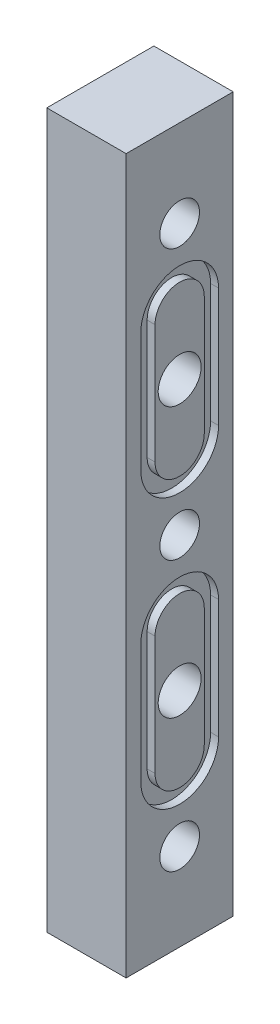
from build123d import *

# Parameters (mm, degrees)
SKETCH1_W                    = 13.5
SKETCH1_H                    = 90
BOSS_EXTRUDE1_DEPTH          = 10
F_1_4_28_TAPPED_HOLE1_D      = 5.4102
F_5_0_5_DIAMETER_HOLE1_D     = 5
F_5_0_5_DIAMETER_HOLE1_DEPTH = 49.5
F_5_0_5_DIAMETER_HOLE1_TIP   = 1.502151548
CUT_EXTRUDE1_DEPTH           = 1
CUT_EXTRUDE2_DEPTH           = 5


with BuildPart() as part:
    # Sketch1 → Boss-Extrude1 (new body)
    with BuildSketch(Plane(origin=(0, 0, 0), x_dir=(0, 0, -1), z_dir=(1, 0, 0))):
        with Locations((1.965094474, 8.62782)):
            Rectangle(SKETCH1_W, SKETCH1_H)
    extrude(amount=BOSS_EXTRUDE1_DEPTH)

    # 1/4-28 Tapped Hole1 (through all)
    with Locations(Plane(origin=(10, 0, 0), x_dir=(0, 0, -1), z_dir=(1, 0, 0))):
        with Locations((1.965094474, 25.62782), (1.965094474, -8.37218)):
            Hole(F_1_4_28_TAPPED_HOLE1_D / 2)

    # Ø5.0 (5) Diameter Hole1
    with Locations(Plane(origin=(10, 0, 0), x_dir=(0, 0, -1), z_dir=(1, 0, 0))):
        with Locations((1.965094474, 42.62782), (1.965094474, -25.37218), (1.965094474, 8.62782)):
            Hole(F_5_0_5_DIAMETER_HOLE1_D / 2, depth=F_5_0_5_DIAMETER_HOLE1_DEPTH)
            with Locations((0, 0, -(F_5_0_5_DIAMETER_HOLE1_DEPTH + F_5_0_5_DIAMETER_HOLE1_TIP / 2))):  # 118° drill point
                Cone(0, F_5_0_5_DIAMETER_HOLE1_D / 2, F_5_0_5_DIAMETER_HOLE1_TIP, mode=Mode.SUBTRACT)

    # Sketch6 → Cut-Extrude1 (cut)
    # profile 1 of 2: a face of its own
    with BuildSketch(Plane(origin=(10, 0, 0), x_dir=(0, 0, -1), z_dir=(1, 0, 0))):
        with BuildLine():
            Line((6.865094474, 33.12782), (6.865094474, 18.12782))
            ThreePointArc((6.865094474, 18.12782), (1.965094474, 13.22782), (-2.934905526, 18.12782))
            Line((-2.934905526, 18.12782), (-2.934905526, 33.12782))
            ThreePointArc((-2.934905526, 33.12782), (1.965094474, 38.02782), (6.865094474, 33.12782))
        make_face()
        with BuildLine():
            Line((5.065094474, 33.12782), (5.065094474, 18.12782))
            ThreePointArc((5.065094474, 18.12782), (1.965094474, 15.02782), (-1.134905526, 18.12782))
            Line((-1.134905526, 18.12782), (-1.134905526, 33.12782))
            ThreePointArc((-1.134905526, 33.12782), (1.965094474, 36.22782), (5.065094474, 33.12782))
        make_face(mode=Mode.SUBTRACT)
    # profile 2 of 2: a face of its own
    with BuildSketch(Plane(origin=(10, 0, 0), x_dir=(0, 0, -1), z_dir=(1, 0, 0))):
        with BuildLine():
            Line((6.865094474, -0.87218), (6.865094474, -15.87218))
            ThreePointArc((6.865094474, -15.87218), (1.965094474, -20.77218), (-2.934905526, -15.87218))
            Line((-2.934905526, -15.87218), (-2.934905526, -0.87218))
            ThreePointArc((-2.934905526, -0.87218), (1.965094474, 4.02782), (6.865094474, -0.87218))
        make_face()
        with BuildLine():
            Line((5.065094474, -0.87218), (5.065094474, -15.87218))
            ThreePointArc((5.065094474, -15.87218), (1.965094474, -18.97218), (-1.134905526, -15.87218))
            Line((-1.134905526, -15.87218), (-1.134905526, -0.87218))
            ThreePointArc((-1.134905526, -0.87218), (1.965094474, 2.22782), (5.065094474, -0.87218))
        make_face(mode=Mode.SUBTRACT)
    extrude(amount=-CUT_EXTRUDE1_DEPTH, mode=Mode.SUBTRACT)

    # Sketch7 → Cut-Extrude2 (cut)
    with BuildSketch(Plane.ZY):
        Polygon((2.009905526, 40.33285268), (2.009905526, 44.92278732), (-1.965094474, 47.21775464), (-5.940094474, 44.92278732), (-5.940094474, 40.33285268), (-1.965094474, 38.03788536), align=None)
        Polygon((2.009905526, 6.33285268), (2.009905526, 10.92278732), (-1.965094474, 13.21775464), (-5.940094474, 10.92278732), (-5.940094474, 6.33285268), (-1.965094474, 4.03788536), align=None)
        Polygon((2.009905526, -27.66714732), (2.009905526, -23.07721268), (-1.965094474, -20.78224536), (-5.940094474, -23.07721268), (-5.940094474, -27.66714732), (-1.965094474, -29.96211464), align=None)
    extrude(amount=-CUT_EXTRUDE2_DEPTH, mode=Mode.SUBTRACT)


solid = part.part
